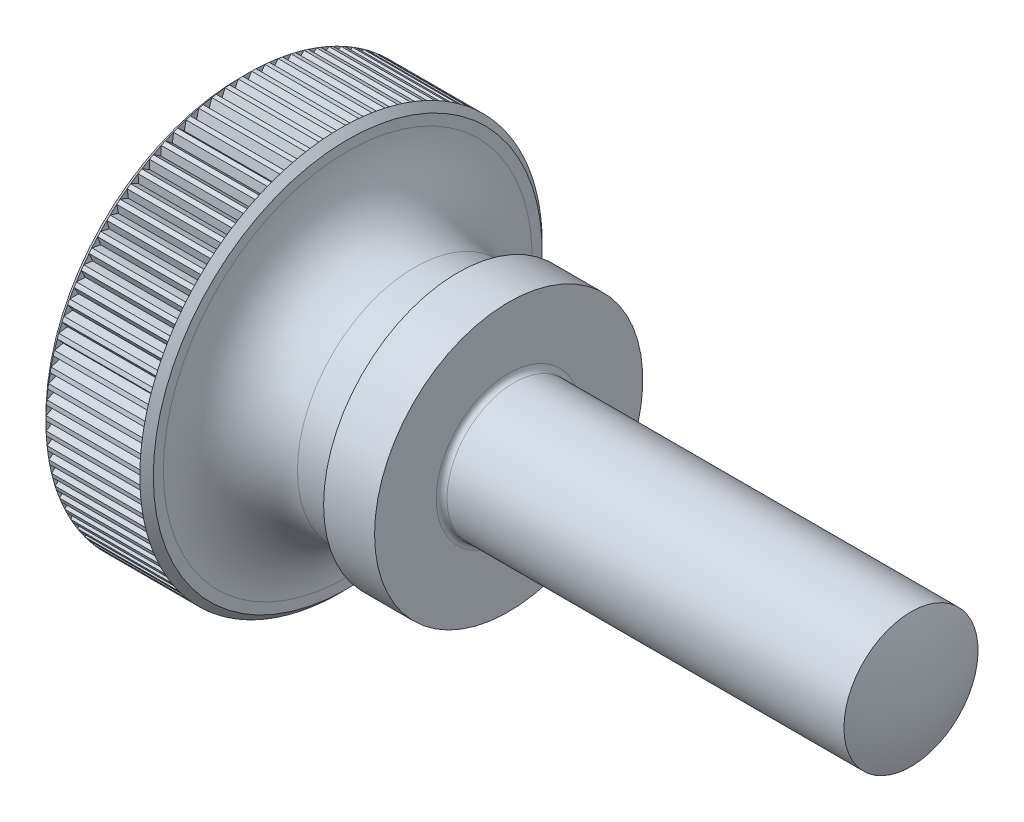
from build123d import *

# Parameters (mm, degrees)
FILLET1_R               = 5
CHAMFER1_SIZE           = 0.5
CUT_EXTRUDE1_DEPTH      = 7
CIRCULAR_PATTERN1_COUNT = 95
FILLET2_R               = 0.4


with BuildPart() as part:
    # Sketch1 → Base (revolve)
    with BuildSketch(Plane.XY):
        with BuildLine():
            Line((0, 0), (0, 15))
            Line((0, 15), (8, 15))
            Line((8, 15), (8, 8.75))
            Line((8, 8.75), (16.2, 8.75))
            Line((16.2, 8.75), (16.2, 10))
            Line((16.2, 10), (20, 10))
            Line((20, 10), (20, 5))
            Line((20, 5), (50, 5))
            ThreePointArc((50, 5), (50.690542465, 2.542267135), (50.923303169, 0))
            Line((50.923303169, 0), (0, 0))
        make_face()
    revolve(axis=Axis((-48.211075441, 0, 0), (1, 0, 0)))

    # Fillet1
    fillet1_edges = [part.edges().sort_by_distance(p)[0] for p in [
        (8, -8.75, 0),
    ]]
    fillet(fillet1_edges, radius=FILLET1_R)

    # Chamfer1
    chamfer1_edges = [part.edges().sort_by_distance(p)[0] for p in [
        (8, -15, 0),
        (0, -15, 0),
    ]]
    chamfer(chamfer1_edges, length=CHAMFER1_SIZE)

    # Sketch2 → Cut-Extrude1 (cut)
    with BuildSketch(Plane(origin=(0.5, 0, 0), x_dir=(0, 0, -1), z_dir=(1, 0, 0))):
        Polygon((0, 14.422649731), (0.5, 15.288675135), (-0.5, 15.288675135), align=None)
    cut_extrude1 = extrude(amount=CUT_EXTRUDE1_DEPTH, mode=Mode.SUBTRACT)

    # Circular-Pattern1: Cut-Extrude1 ×95 about axis
    circular_pattern1_axis = Axis((-48.211075441, 0, 0), (1, 0, 0))
    for i in range(1, CIRCULAR_PATTERN1_COUNT):
        add(cut_extrude1.rotate(circular_pattern1_axis, i * 360 / CIRCULAR_PATTERN1_COUNT), mode=Mode.SUBTRACT)

    # Fillet2
    fillet2_edges = [part.edges().sort_by_distance(p)[0] for p in [
        (20, -5, 0),
    ]]
    fillet(fillet2_edges, radius=FILLET2_R)


solid = part.part
